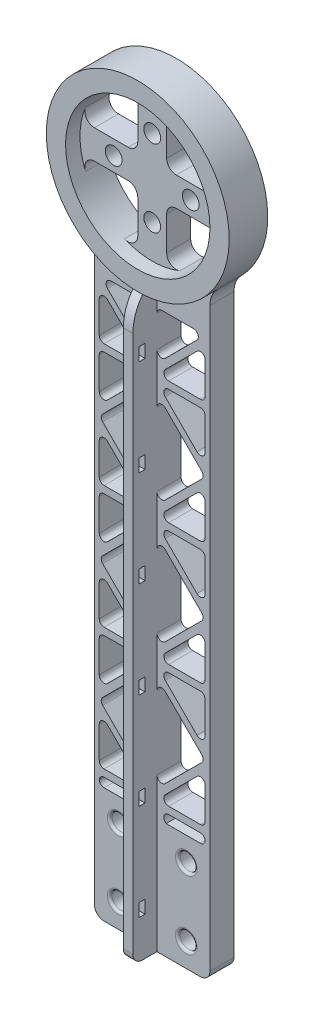
from build123d import *

# Parameters (mm, degrees)
BOSS_EXTRUDE2_DEPTH = 8
BOSS_EXTRUDE3_DEPTH = 5
FILLET1_R           = 2
SKETCH6_R           = 1.75
CUT_EXTRUDE2_DEPTH  = 5
BOSS_EXTRUDE4_DEPTH = 5
FILLET2_R           = 5
CUT_EXTRUDE4_DEPTH  = 5
SKETCH10_W          = 24
SKETCH10_H          = 24
BOSS_EXTRUDE5_DEPTH = 5
FILLET12_R          = 2
SKETCH11_R          = 1.75
CUT_EXTRUDE7_DEPTH  = 5
BOSS_EXTRUDE6_DEPTH = 5
FILLET20_R          = 2
FILLET21_R          = 10
FILLET23_R          = 1
SKETCH13_W          = 1.25
SKETCH13_H          = 2.7
CUT_EXTRUDE8_DEPTH  = 2
LPATTERN1_COUNT     = 6
LPATTERN1_PITCH     = 20
FILLET24_R          = 0.5


with BuildPart() as part:
    # Sketch2 → Boss-Extrude2 (new body)
    with BuildSketch(Plane.XY):
        with BuildLine():
            ThreePointArc((19, 0), (-8.154753215, 17.161002302), (-12, -14.730919863))
            ThreePointArc((-12, -14.730919863), (0, -19), (12, -14.730919863))
            ThreePointArc((12, -14.730919863), (17.161002302, -8.154753215), (19, 0))
        make_face()
        with BuildLine():
            ThreePointArc((-14.696938457, 3), (-10.606601718, 10.606601718), (-3, 14.696938457))
            ThreePointArc((-3, 14.696938457), (0, 15), (3, 14.696938457))
            ThreePointArc((3, 14.696938457), (10.606601718, 10.606601718), (14.696938457, 3))
            ThreePointArc((14.696938457, 3), (14.924042295, 1.50763443), (15, 0))
            ThreePointArc((15, 0), (14.924042295, -1.50763443), (14.696938457, -3))
            ThreePointArc((14.696938457, -3), (10.606601718, -10.606601718), (3, -14.696938457))
            ThreePointArc((3, -14.696938457), (0, -15), (-3, -14.696938457))
            ThreePointArc((-3, -14.696938457), (-10.606601718, -10.606601718), (-14.696938457, -3))
            ThreePointArc((-14.696938457, -3), (-15, 0), (-14.696938457, 3))
        make_face(mode=Mode.SUBTRACT)
    extrude(amount=BOSS_EXTRUDE2_DEPTH)

    # Sketch2<6> → Boss-Extrude3 (add)
    with BuildSketch(Plane.XY):
        with BuildLine():
            ThreePointArc((3, 14.696938457), (0, 15), (-3, 14.696938457))
            Line((-3, 14.696938457), (-3, 3))
            Line((-3, 3), (-14.696938457, 3))
            ThreePointArc((-14.696938457, 3), (-15, 0), (-14.696938457, -3))
            Line((-14.696938457, -3), (-3, -3))
            Line((-3, -3), (-3, -14.696938457))
            ThreePointArc((-3, -14.696938457), (0, -15), (3, -14.696938457))
            Line((3, -14.696938457), (3, -3))
            Line((3, -3), (14.696938457, -3))
            ThreePointArc((14.696938457, -3), (14.924042295, -1.50763443), (15, 0))
            ThreePointArc((15, 0), (14.924042295, 1.50763443), (14.696938457, 3))
            Line((14.696938457, 3), (3, 3))
            Line((3, 3), (3, 14.696938457))
        make_face()
    extrude(amount=BOSS_EXTRUDE3_DEPTH)

    # Fillet1
    # the kernel refuses this fillet: 2 mm, written as the material it adds along each edge
    with BuildSketch(Plane(origin=(3, 3, 0), x_dir=(0, 1, 0), z_dir=(0, 0, 1)), Plane(origin=(-3, 3, 0), x_dir=(-1, 0, 0), z_dir=(0, 0, 1)), Plane(origin=(-3, -3, 0), x_dir=(0, -1, 0), z_dir=(0, 0, 1))) as fillet1_piece_1:
        with BuildLine():
            CenterArc((FILLET1_R, -FILLET1_R), FILLET1_R, 90, 90)
            Line((0, -FILLET1_R), (0, 0))
            Line((0, 0), (FILLET1_R, 0))
        make_face()
    extrude(amount=5)
    with BuildSketch(Plane(origin=(3, 14.696938457, 0), x_dir=(0.9559037360078778, -0.29368017891267584, 0), z_dir=(0, 0, 1)), Plane(origin=(-14.696938457, 3, 0), x_dir=(0.293680178912678, 0.9559037360078773, 0), z_dir=(0, 0, 1)), Plane(origin=(-3, -14.696938457, 0), x_dir=(-0.9559037360078788, 0.29368017891267284, 0), z_dir=(0, 0, 1)), Plane(origin=(14.696938457, -3, 0), x_dir=(-0.2936801789126721, -0.955903736007879, 0), z_dir=(0, 0, 1))) as fillet1_piece_2:
        with BuildLine():
            CenterArc((2.70384484, -1.990653189), FILLET1_R, 84.458547042, 112.619864948)
            Line((0.792037368, -2.578013547), (0, 0))
            ThreePointArc((0, 0), (1.448488307, 0.070101085), (2.896976615, 0))
        make_face()
    extrude(amount=5)
    with BuildSketch(Plane(origin=(-3, 14.696938457, 0), x_dir=(-0.9559037360078776, -0.2936801789126773, 0), z_dir=(0, 0, 1)), Plane(origin=(-14.696938457, -3, 0), x_dir=(0.29368017891267584, -0.9559037360078778, 0), z_dir=(0, 0, 1)), Plane(origin=(3, -14.696938457, 0), x_dir=(0.9559037360078789, 0.2936801789126722, 0), z_dir=(0, 0, 1)), Plane(origin=(14.696938457, 3, 0), x_dir=(-0.29368017891267406, 0.9559037360078784, 0), z_dir=(0, 0, 1))) as fillet1_piece_3:
        with BuildLine():
            CenterArc((2.70384484, 1.990653189), FILLET1_R, 162.92158801, 112.619864948)
            Line((0.792037368, 2.578013547), (0, 0))
            ThreePointArc((0, 0), (1.448488307, -0.070101085), (2.896976615, 0))
        make_face()
    extrude(amount=5)
    with BuildSketch(Plane(origin=(3, -3, 0), x_dir=(0, -1, 0), z_dir=(0, 0, 1))) as fillet1_piece_4:
        with BuildLine():
            CenterArc((FILLET1_R, FILLET1_R), FILLET1_R, 180, 90)
            Line((0, FILLET1_R), (0, 0))
            Line((0, 0), (FILLET1_R, 0))
        make_face()
    extrude(amount=5)

    # Sketch6 → Cut-Extrude2 (cut)
    with BuildSketch(Plane.XY):
        with Locations((8, 0)):
            Circle(SKETCH6_R)
        with Locations((0, 8)):
            Circle(SKETCH6_R)
        with Locations((-8, 0)):
            Circle(SKETCH6_R)
        with Locations((0, -8)):
            Circle(SKETCH6_R)
    extrude(amount=CUT_EXTRUDE2_DEPTH, mode=Mode.SUBTRACT)

    # Sketch2<9> → Boss-Extrude4 (add)
    with BuildSketch(Plane.XY):
        with BuildLine():
            ThreePointArc((12, -14.730919863), (0, -19), (-12, -14.730919863))
            Line((-12, -14.730919863), (-12, -114.730919863))
            Line((-12, -114.730919863), (12, -114.730919863))
            Line((12, -114.730919863), (12, -14.730919863))
        make_face()
    extrude(amount=BOSS_EXTRUDE4_DEPTH)

    # Fillet2
    # the kernel refuses this fillet: 5 mm, written as the material it adds along each edge
    with BuildSketch(Plane(origin=(-12, -14.730919863, 0), x_dir=(-0.7415885100104059, 0.6708550378588106, 0), z_dir=(0, 0, 1))) as fillet2_piece_1:
        with BuildLine():
            CenterArc((2.22524928, 4.99330036), FILLET2_R, 222.133091378, 44.900527961)
            Line((-1.48269327, 1.63902517), (0, 0))
            ThreePointArc((0, 0), (0.983249682, 0.025458634), (1.966499364, 0))
        make_face()
    extrude(amount=5)
    with BuildSketch(Plane(origin=(12, -14.730919863, 0), x_dir=(0.7415885100104069, 0.6708550378588094, 0), z_dir=(0, 0, 1))) as fillet2_piece_2:
        with BuildLine():
            CenterArc((2.22524928, -4.99330036), FILLET2_R, 92.966380662, 44.900527961)
            Line((-1.48269327, -1.63902517), (0, 0))
            ThreePointArc((0, 0), (0.983249682, -0.025458634), (1.966499364, 0))
        make_face()
    extrude(amount=5)

    # Sketch9 → Cut-Extrude4 (cut)
    with BuildSketch(Plane.XY.offset(5)):
        Polygon((-1, -191.344160426), (-11, -201.344160426), (-1, -201.344160426), align=None)
        Polygon((-1, -201.344160426), (-11, -201.344160426), (-1, -211.344160426), align=None)
        Polygon((-11, -22.844160426), (-1, -32.844160426), (-1, -22.844160426), align=None)
        Polygon((-1, -34.844160426), (-11, -24.844160426), (-11, -34.844160426), align=None)
        Polygon((11, -22.844160426), (1, -22.844160426), (1, -32.844160426), align=None)
        Polygon((11, -34.844160426), (1, -34.844160426), (11, -24.844160426), align=None)
        Polygon((-11, -36.344160426), (-1, -36.344160426), (-11, -46.344160426), align=None)
        Polygon((-11, -48.344160426), (-1, -58.344160426), (-1, -38.344160426), align=None)
        Polygon((-1, -60.344160426), (-11, -50.344160426), (-11, -60.344160426), align=None)
        Polygon((11, -46.344160426), (11, -36.344160426), (1, -36.344160426), align=None)
        Polygon((11, -48.344160426), (1, -38.344160426), (1, -58.344160426), align=None)
        Polygon((11, -60.344160426), (1, -60.344160426), (11, -50.344160426), align=None)
        Polygon((-11, -61.844160426), (-1, -61.844160426), (-11, -71.844160426), align=None)
        Polygon((-11, -73.844160426), (-1, -83.844160426), (-1, -63.844160426), align=None)
        Polygon((11, -71.844160426), (11, -61.844160426), (1, -61.844160426), align=None)
        Polygon((11, -73.844160426), (1, -63.844160426), (1, -83.844160426), align=None)
        Polygon((-1, -85.844160426), (-11, -75.844160426), (-11, -85.844160426), align=None)
        Polygon((11, -85.844160426), (1, -85.844160426), (11, -75.844160426), align=None)
        Polygon((-11, -87.344160426), (-1, -87.344160426), (-11, -97.344160426), align=None)
        Polygon((11, -97.344160426), (11, -87.344160426), (1, -87.344160426), align=None)
        Polygon((-11, -99.344160426), (-1, -109.344160426), (-1, -89.344160426), align=None)
        Polygon((11, -99.344160426), (1, -89.344160426), (1, -109.344160426), align=None)
        Polygon((11, -111.344160426), (1, -111.344160426), (11, -101.344160426), align=None)
        Polygon((-1, -111.344160426), (-11, -101.344160426), (-11, -111.344160426), align=None)
        Polygon((-11, -112.844160426), (-1, -112.844160426), (-11, -122.844160426), align=None)
        Polygon((11, -122.844160426), (11, -112.844160426), (1, -112.844160426), align=None)
        Polygon((-11, -124.844160426), (-1, -134.844160426), (-1, -114.844160426), align=None)
        Polygon((11, -124.844160426), (1, -114.844160426), (1, -134.844160426), align=None)
        Polygon((-1, -136.844160426), (-11, -126.844160426), (-11, -136.844160426), align=None)
        Polygon((-11, -138.344160426), (-1, -138.344160426), (-11, -148.344160426), align=None)
        Polygon((11, -136.844160426), (1, -136.844160426), (11, -126.844160426), align=None)
        Polygon((11, -148.344160426), (11, -138.344160426), (1, -138.344160426), align=None)
        Polygon((11, -150.344160426), (1, -140.344160426), (1, -160.344160426), align=None)
        Polygon((-11, -150.344160426), (-1, -160.344160426), (-1, -140.344160426), align=None)
        Polygon((-1, -162.344160426), (-11, -152.344160426), (-11, -162.344160426), align=None)
        Polygon((11, -162.344160426), (1, -162.344160426), (11, -152.344160426), align=None)
        Polygon((1, -163.844160426), (11, -173.844160426), (11, -163.844160426), align=None)
        Polygon((-11, -163.844160426), (-1, -163.844160426), (-11, -173.844160426), align=None)
        Polygon((-11, -175.844160426), (-1, -185.844160426), (-1, -165.844160426), align=None)
        Polygon((11, -175.844160426), (1, -165.844160426), (1, -185.844160426), align=None)
        Polygon((11, -177.844160426), (11, -187.844160426), (1, -187.844160426), align=None)
        Polygon((-1, -187.844160426), (-11, -177.844160426), (-11, -187.844160426), align=None)
        Polygon((-11, -189.344160426), (-1, -189.344160426), (-11, -199.344160426), align=None)
        Polygon((11, -199.344160426), (11, -189.344160426), (1, -189.344160426), align=None)
        Polygon((11, -201.344160426), (1, -191.344160426), (1, -211.344160426), align=None)
        Polygon((11, -213.344160426), (1, -213.344160426), (11, -203.344160426), align=None)
        Polygon((-1, -213.344160426), (-11, -203.344160426), (-11, -213.344160426), align=None)
    extrude(amount=-CUT_EXTRUDE4_DEPTH, mode=Mode.SUBTRACT)

    # Sketch10 → Boss-Extrude5 (add)
    with BuildSketch(Plane.XY):
        with Locations((0, -126.730919863)):
            Rectangle(SKETCH10_W, SKETCH10_H)
    extrude(amount=BOSS_EXTRUDE5_DEPTH)

    # Fillet12
    fillet12_edges = [part.edges().sort_by_distance(p)[0] for p in [
        (-12, -138.730919863, 2.5),
        (12, -138.730919863, 2.5),
    ]]
    fillet(fillet12_edges, radius=FILLET12_R)

    # Sketch11 → Cut-Extrude7 (cut)
    with BuildSketch(Plane.XY):
        with Locations((-7.071067812, -119.659852051)):
            Circle(SKETCH11_R)
        with Locations((7.071067812, -119.659852051)):
            Circle(SKETCH11_R)
        with Locations((-7.071067812, -133.801987675)):
            Circle(SKETCH11_R)
        with Locations((7.071067812, -133.801987675)):
            Circle(SKETCH11_R)
    extrude(amount=CUT_EXTRUDE7_DEPTH, mode=Mode.SUBTRACT)

    # Sketch12 → Boss-Extrude6 (add)
    with BuildSketch(Plane.XY.offset(5)):
        with BuildLine():
            Line((-1, -102.118389076), (-1, -138.730919863))
            Line((-1, -138.730919863), (1, -138.730919863))
            Line((1, -138.730919863), (1, -105.248134093))
            Line((1, -105.248134093), (1, -26.079975433))
            Line((1, -26.079975433), (1, -18.973665961))
            ThreePointArc((1, -18.973665961), (0, -19), (-1, -18.973665961))
            Line((-1, -18.973665961), (-1, -102.118389076))
        make_face()
    extrude(amount=BOSS_EXTRUDE6_DEPTH)

    # Fillet20
    fillet20_edges = [part.edges().sort_by_distance(p)[0] for p in [
        (0, -138.730919863, 10),
    ]]
    fillet(fillet20_edges, radius=FILLET20_R)

    # Fillet21
    # the kernel refuses this fillet: 10 mm, written as the material it takes off along each edge
    with BuildSketch(Plane(origin=(0, 0, 10), x_dir=(0.7460638030960594, -0.6658744639268308, 0), z_dir=(0.6658744639268308, 0.7460638030960594, 0))) as fillet21_piece_1:
        with BuildLine():
            CenterArc((25, 10), FILLET21_R, 233.130102354, 36.869897646)
            Line((19, 2), (18.88, 1.84))
            ThreePointArc((18.88, 1.84), (18.8, 1), (18.8, 0))
            Line((18.8, 0), (19, -0.2))
            Line((19, -0.2), (25, -0.2))
            Line((25, -0.2), (25, 0))
        make_face()
    revolve(axis=Axis((0, 0, 10), (0, 0, -1)), revolution_arc=96.501106206, mode=Mode.SUBTRACT)

    # Fillet23
    # the kernel refuses this fillet: 1 mm, written as the material it adds along each edge
    with BuildSketch(Plane(origin=(11, -114.730919863, 5), x_dir=(0, 1, 0), z_dir=(0, 0, -1)), Plane(origin=(-11, -114.730919863, 5), x_dir=(1, 0, 0), z_dir=(0, 0, -1)), Plane(origin=(11, -60.344160426, 5), x_dir=(0, 1, 0), z_dir=(0, 0, -1)), Plane(origin=(11, -48.344160426, 5), x_dir=(-0.7071067811865485, 0.7071067811865467, 0), z_dir=(0, 0, -1)), Plane(origin=(-11, -73.844160426, 5), x_dir=(0.7071067811865468, -0.7071067811865486, 0), z_dir=(0, 0, -1)), Plane(origin=(-11, -61.844160426, 5), x_dir=(0, -1, 0), z_dir=(0, 0, -1)), Plane(origin=(11, -85.844160426, 5), x_dir=(0, 1, 0), z_dir=(0, 0, -1)), Plane(origin=(11, -73.844160426, 5), x_dir=(-0.7071067811865485, 0.7071067811865467, 0), z_dir=(0, 0, -1)), Plane(origin=(-11, -48.344160426, 5), x_dir=(0.7071067811865485, -0.7071067811865467, 0), z_dir=(0, 0, -1)), Plane(origin=(-11, -36.344160426, 5), x_dir=(0, -1, 0), z_dir=(0, 0, -1)), Plane(origin=(11, -34.844160426, 5), x_dir=(0, 1, 0), z_dir=(0, 0, -1)), Plane(origin=(-1, -22.844160426, 5), x_dir=(-1, 0, 0), z_dir=(0, 0, -1)), Plane(origin=(11, -99.344160426, 5), x_dir=(-0.7071067811865511, 0.707106781186544, 0), z_dir=(0, 0, -1)), Plane(origin=(-11, -99.344160426, 5), x_dir=(0.7071067811865495, -0.7071067811865459, 0), z_dir=(0, 0, -1)), Plane(origin=(-11, -87.344160426, 5), x_dir=(0, -1, 0), z_dir=(0, 0, -1)), Plane(origin=(11, -111.344160426, 5), x_dir=(0, 1, 0), z_dir=(0, 0, -1))) as fillet23_piece_1:
        with BuildLine():
            CenterArc((FILLET23_R, -FILLET23_R), FILLET23_R, 90, 90)
            Line((0, -FILLET23_R), (0, 0))
            Line((0, 0), (FILLET23_R, 0))
        make_face()
    extrude(amount=5)
    with BuildSketch(Plane(origin=(1, -60.344160426, 5), x_dir=(0.707106781186547, 0.7071067811865481, 0), z_dir=(0, 0, -1)), Plane(origin=(1, -38.344160426, 5), x_dir=(0.7071067811865482, -0.7071067811865467, 0), z_dir=(0, 0, -1)), Plane(origin=(-1, -83.844160426, 5), x_dir=(-0.7071067811865452, 0.7071067811865498, 0), z_dir=(0, 0, -1)), Plane(origin=(-1, -61.844160426, 5), x_dir=(-0.7071067811865472, -0.7071067811865478, 0), z_dir=(0, 0, -1)), Plane(origin=(1, -85.844160426, 5), x_dir=(0.7071067811865464, 0.7071067811865488, 0), z_dir=(0, 0, -1)), Plane(origin=(-11, -75.844160426, 5), x_dir=(0.7071067811865465, -0.7071067811865486, 0), z_dir=(0, 0, -1)), Plane(origin=(1, -61.844160426, 5), x_dir=(1, 0, 0), z_dir=(0, 0, -1)), Plane(origin=(1, -63.844160426, 5), x_dir=(0.7071067811865467, -0.7071067811865485, 0), z_dir=(0, 0, -1)), Plane(origin=(-1, -58.344160426, 5), x_dir=(-0.7071067811865464, 0.7071067811865489, 0), z_dir=(0, 0, -1)), Plane(origin=(-1, -36.344160426, 5), x_dir=(-0.7071067811865471, -0.7071067811865479, 0), z_dir=(0, 0, -1)), Plane(origin=(-11, -50.344160426, 5), x_dir=(0.7071067811865471, -0.7071067811865478, 0), z_dir=(0, 0, -1)), Plane(origin=(1, -36.344160426, 5), x_dir=(1, 0, 0), z_dir=(0, 0, -1)), Plane(origin=(1, -34.844160426, 5), x_dir=(0.7071067811865466, 0.7071067811865486, 0), z_dir=(0, 0, -1)), Plane(origin=(-1, -32.844160426, 5), x_dir=(-0.7071067811865469, 0.7071067811865482, 0), z_dir=(0, 0, -1)), Plane(origin=(-11, -24.844160426, 5), x_dir=(0.7071067811865472, -0.7071067811865479, 0), z_dir=(0, 0, -1)), Plane(origin=(1, -89.344160426, 5), x_dir=(0.7071067811865472, -0.7071067811865478, 0), z_dir=(0, 0, -1)), Plane(origin=(-1, -109.344160426, 5), x_dir=(-0.707106781186548, 0.707106781186547, 0), z_dir=(0, 0, -1)), Plane(origin=(1, -87.344160426, 5), x_dir=(1, 0, 0), z_dir=(0, 0, -1)), Plane(origin=(-1, -87.344160426, 5), x_dir=(-0.7071067811865474, -0.7071067811865476, 0), z_dir=(0, 0, -1)), Plane(origin=(1, -111.344160426, 5), x_dir=(0.7071067811865485, 0.7071067811865467, 0), z_dir=(0, 0, -1)), Plane(origin=(-11, -101.344160426, 5), x_dir=(0.707106781186546, -0.707106781186549, 0), z_dir=(0, 0, -1)), Plane(origin=(-1, -112.844160426, 5), x_dir=(-0.7071067811865485, -0.7071067811865466, 0), z_dir=(0, 0, -1)), Plane(origin=(1, -112.844160426, 5), x_dir=(1, 0, 0), z_dir=(0, 0, -1))) as fillet23_piece_2:
        with BuildLine():
            CenterArc((FILLET23_R * 2.41421356237, FILLET23_R), FILLET23_R, 135, 135)
            Line((FILLET23_R * 1.70710678119, FILLET23_R * 1.70710678119), (0, 0))
            Line((0, 0), (FILLET23_R * 2.41421356237, 0))
        make_face()
    extrude(amount=5)
    with BuildSketch(Plane(origin=(11, -50.344160426, 5), x_dir=(-0.7071067811865468, -0.7071067811865482, 0), z_dir=(0, 0, -1)), Plane(origin=(1, -58.344160426, 5), x_dir=(0.7071067811865467, 0.7071067811865483, 0), z_dir=(0, 0, -1)), Plane(origin=(-1, -63.844160426, 5), x_dir=(-0.7071067811865468, -0.7071067811865485, 0), z_dir=(0, 0, -1)), Plane(origin=(-11, -71.844160426, 5), x_dir=(0.7071067811865457, 0.7071067811865495, 0), z_dir=(0, 0, -1)), Plane(origin=(11, -75.844160426, 5), x_dir=(-0.7071067811865465, -0.7071067811865486, 0), z_dir=(0, 0, -1)), Plane(origin=(-1, -85.844160426, 5), x_dir=(-0.7071067811865474, 0.7071067811865476, 0), z_dir=(0, 0, -1)), Plane(origin=(11, -71.844160426, 5), x_dir=(0, 1, 0), z_dir=(0, 0, -1)), Plane(origin=(1, -83.844160426, 5), x_dir=(0.707106781186546, 0.707106781186549, 0), z_dir=(0, 0, -1)), Plane(origin=(-1, -38.344160426, 5), x_dir=(-0.7071067811865474, -0.7071067811865478, 0), z_dir=(0, 0, -1)), Plane(origin=(-11, -46.344160426, 5), x_dir=(0.7071067811865468, 0.7071067811865482, 0), z_dir=(0, 0, -1)), Plane(origin=(-1, -60.344160426, 5), x_dir=(-0.7071067811865476, 0.7071067811865476, 0), z_dir=(0, 0, -1)), Plane(origin=(11, -46.344160426, 5), x_dir=(0, 1, 0), z_dir=(0, 0, -1)), Plane(origin=(11, -22.844160426, 5), x_dir=(-1, 0, 0), z_dir=(0, 0, -1)), Plane(origin=(1, -32.844160426, 5), x_dir=(0.7071067811865469, 0.707106781186548, 0), z_dir=(0, 0, -1)), Plane(origin=(11, -24.844160426, 5), x_dir=(-0.7071067811865468, -0.7071067811865482, 0), z_dir=(0, 0, -1)), Plane(origin=(-11, -22.844160426, 5), x_dir=(0.7071067811865471, -0.7071067811865479, 0), z_dir=(0, 0, -1)), Plane(origin=(-1, -34.844160426, 5), x_dir=(-0.7071067811865471, 0.7071067811865479, 0), z_dir=(0, 0, -1)), Plane(origin=(1, -109.344160426, 5), x_dir=(0.7071067811865472, 0.7071067811865478, 0), z_dir=(0, 0, -1)), Plane(origin=(-1, -89.344160426, 5), x_dir=(-0.707106781186546, -0.7071067811865489, 0), z_dir=(0, 0, -1)), Plane(origin=(11, -97.344160426, 5), x_dir=(0, 1, 0), z_dir=(0, 0, -1)), Plane(origin=(-11, -97.344160426, 5), x_dir=(0.7071067811865471, 0.7071067811865478, 0), z_dir=(0, 0, -1)), Plane(origin=(11, -101.344160426, 5), x_dir=(-0.707106781186546, -0.707106781186549, 0), z_dir=(0, 0, -1)), Plane(origin=(-1, -111.344160426, 5), x_dir=(-0.7071067811865485, 0.7071067811865467, 0), z_dir=(0, 0, -1))) as fillet23_piece_3:
        with BuildLine():
            CenterArc((FILLET23_R * 2.41421356237, -FILLET23_R), FILLET23_R, 90, 135)
            Line((FILLET23_R * 1.70710678119, -FILLET23_R * 1.70710678119), (0, 0))
            Line((0, 0), (FILLET23_R * 2.41421356237, 0))
        make_face()
    extrude(amount=5)
    with BuildSketch(Plane(origin=(-11, -85.844160426, 5), x_dir=(0, 1, 0), z_dir=(0, 0, -1)), Plane(origin=(11, -61.844160426, 5), x_dir=(0, -1, 0), z_dir=(0, 0, -1)), Plane(origin=(-11, -60.344160426, 5), x_dir=(0, 1, 0), z_dir=(0, 0, -1)), Plane(origin=(11, -36.344160426, 5), x_dir=(0, -1, 0), z_dir=(0, 0, -1)), Plane(origin=(1, -22.844160426, 5), x_dir=(1, 0, 0), z_dir=(0, 0, -1)), Plane(origin=(-11, -34.844160426, 5), x_dir=(0, 1, 0), z_dir=(0, 0, -1)), Plane(origin=(11, -87.344160426, 5), x_dir=(0, -1, 0), z_dir=(0, 0, -1)), Plane(origin=(-11, -111.344160426, 5), x_dir=(0, 1, 0), z_dir=(0, 0, -1)), Plane(origin=(-11, -112.844160426, 5), x_dir=(1, 0, 0), z_dir=(0, 0, -1)), Plane(origin=(11, -112.844160426, 5), x_dir=(0, -1, 0), z_dir=(0, 0, -1))) as fillet23_piece_4:
        with BuildLine():
            CenterArc((FILLET23_R, FILLET23_R), FILLET23_R, 180, 90)
            Line((0, FILLET23_R), (0, 0))
            Line((0, 0), (FILLET23_R, 0))
        make_face()
    extrude(amount=5)

    # Sketch13 → Cut-Extrude8 (cut)
    with BuildSketch(Plane(origin=(1, 0, 0), x_dir=(0, 0, -1), z_dir=(1, 0, 0))):
        with Locations((-8.125, -129.380919863)):
            Rectangle(SKETCH13_W, SKETCH13_H)
    cut_extrude8 = extrude(amount=-CUT_EXTRUDE8_DEPTH, mode=Mode.SUBTRACT)

    # LPattern1: Cut-Extrude8 ×6
    with Locations(*[(0, i * LPATTERN1_PITCH, 0) for i in range(1, LPATTERN1_COUNT)]):
        add(cut_extrude8, mode=Mode.SUBTRACT)

    # Fillet24
    fillet24_edges = [part.edges().sort_by_distance(p)[0] for p in [
        (5.321067812, -119.659852051, 5),
        (-8.821067812, -133.801987675, 5),
        (5.321067812, -133.801987675, 5),
        (-8.821067812, -119.659852051, 5),
    ]]
    fillet(fillet24_edges, radius=FILLET24_R)


solid = part.part
